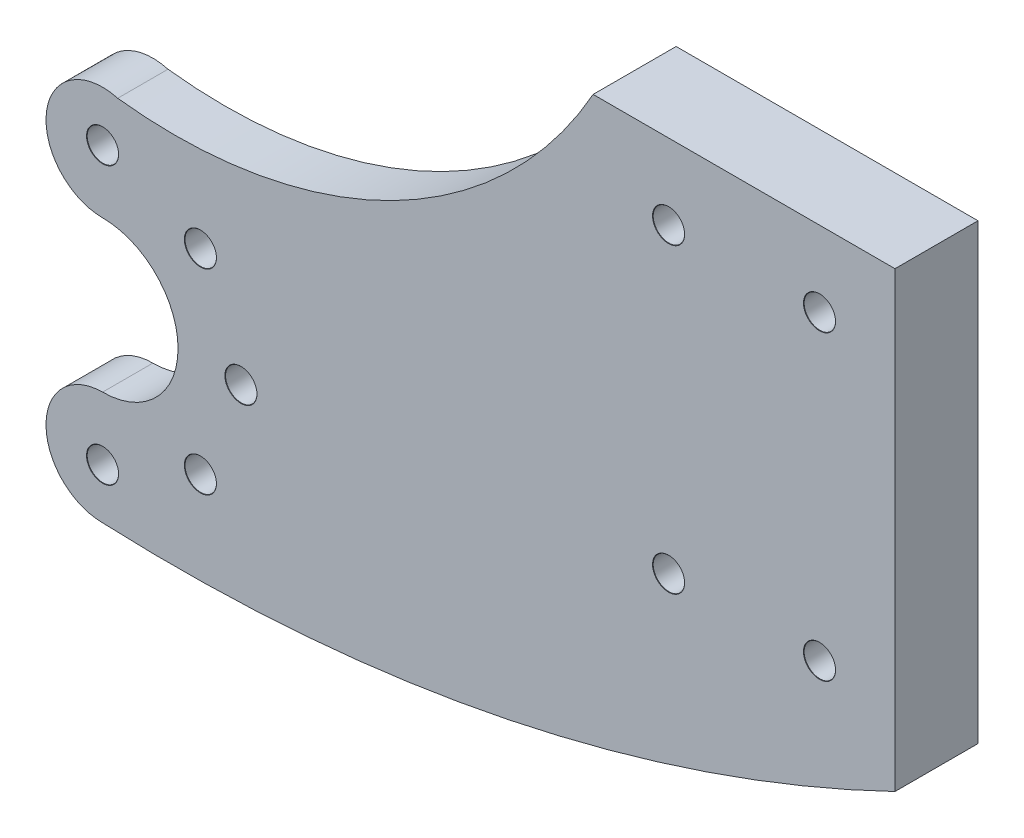
from build123d import *

# Parameters (mm, degrees)
SKETCH_1_W            = 24
SKETCH_1_H            = 36
EXTRUDE_1_DEPTH       = 2.6
EXTRUDE_2_DEPTH       = 4
F_2_5MM_1_D           = 2.5
F_2_5MM_1_CSINK_D     = 2.55
F_2_5MM_1_CSINK_ANGLE = 90
F_2_5MM_2_D           = 2.5
F_2_5MM_2_CSINK_D     = 2.55
F_2_5MM_2_CSINK_ANGLE = 90


with BuildPart() as part:
    # 草图1 → 凸台-拉伸1 (new body)
    with BuildSketch(Plane.XY):
        with Locations((-12, 18)):
            Rectangle(SKETCH_1_W, SKETCH_1_H)
    extrude(amount=EXTRUDE_1_DEPTH)

    # 草图4 → 凸台-拉伸2 (add)
    with BuildSketch(Plane.XY.offset(2.6)):
        with BuildLine():
            Line((-63, 8.00100493), (-63, 8))
            ThreePointArc((-63, 8), (-57, 2), (-63, -4))
            Line((-63, -4), (-63, -4.00100493))
            ThreePointArc((-63, -4.00100493), (-67.49899507, -8.5), (-63, -12.99899507))
            ThreePointArc((-63, -12.99899507), (-30.69264412, -10.412370813), (0, 0))
            Line((0, 0), (0, 36))
            Line((0, 36), (-24, 36))
            ThreePointArc((-24, 36), (-39.993336466, 20.688173979), (-61.796842954, 16.835132035))
            ThreePointArc((-61.796842954, 16.835132035), (-67.457841086, 13.107132187), (-63, 8.00100493))
        make_face()
    extrude(amount=EXTRUDE_2_DEPTH)

    # Ø2.5mm 暗销孔1 (through all)
    with Locations(Plane.XY.offset(6.6)):
        with Locations((-63, -9), (-63, 13), (-55.221825407, 9.778174593), (-52, 2), (-55.221825407, -5.778174593)):
            CounterSinkHole(F_2_5MM_1_D / 2, F_2_5MM_1_CSINK_D / 2, counter_sink_angle=F_2_5MM_1_CSINK_ANGLE)

    # Ø2.5mm 暗销孔2 (through all)
    with Locations(Plane.XY.offset(6.6)):
        with Locations((-6, 30), (-18, 30), (-18, 6), (-6, 6)):
            CounterSinkHole(F_2_5MM_2_D / 2, F_2_5MM_2_CSINK_D / 2, counter_sink_angle=F_2_5MM_2_CSINK_ANGLE)


solid = part.part
